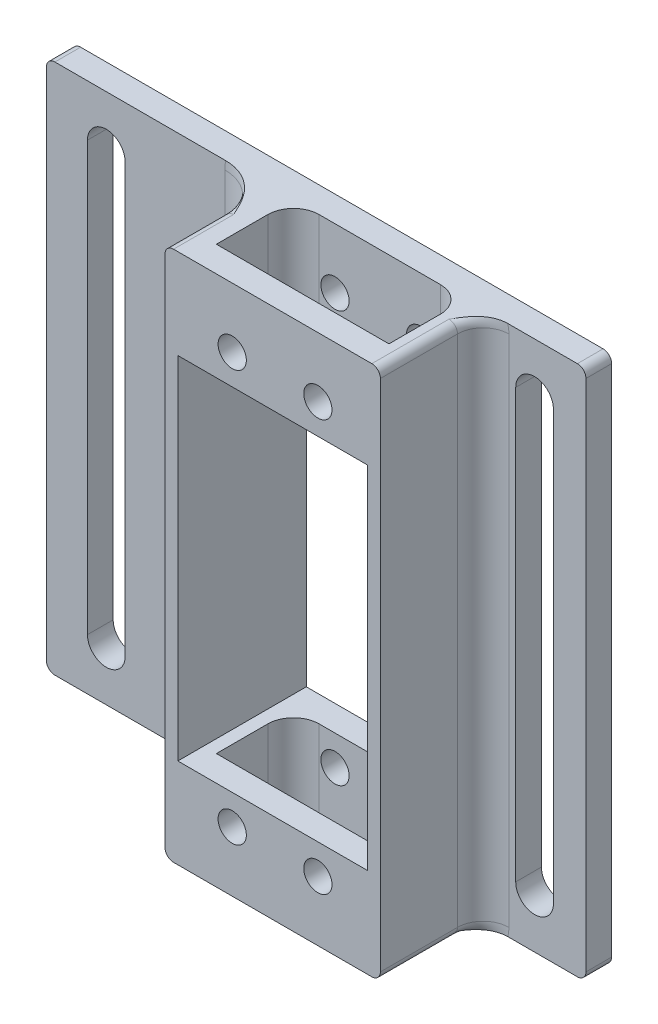
from build123d import *

# Parameters (mm, degrees)
SKETCH_1_W          = 63
SKETCH_1_H          = 62
EXTRUDE_1_DEPTH     = 3
SKETCH_2_W          = 25.15
SKETCH_2_H          = 62
SKETCH_2_R          = 1.65
EXTRUDE_2_DEPTH     = 12
CUT_EXTRUDE_START   = -45
SKETCH_4_R          = 1.65
SKETCH_4_W          = 22.15
SKETCH_4_H          = 41
CUT_EXTRUDE_4_DEPTH = 45
FILLET_1_R          = 1
FILLET_2_R          = 5
SKETCH_5_W          = 20.15
SKETCH_5_H          = 9
CUT_EXTRUDE_5_DEPTH = 70
FILLET_3_R          = 3
FILLET_4_R          = 3


with BuildPart() as part:
    # 草图1 → 凸台-拉伸1 (new body)
    with BuildSketch(Plane.XY):
        with Locations((3.5, -25)):
            Rectangle(SKETCH_1_W, SKETCH_1_H)
        with BuildLine():
            Line((26.8, 0), (26.8, -50))
            ThreePointArc((26.8, -50), (29, -52.2), (31.2, -50))
            Line((31.2, -50), (31.2, 0))
            ThreePointArc((31.2, 0), (29, 2.2), (26.8, 0))
        make_face(mode=Mode.SUBTRACT)
        with BuildLine():
            Line((-23.2, 0), (-23.2, -50))
            ThreePointArc((-23.2, -50), (-21, -52.2), (-18.8, -50))
            Line((-18.8, -50), (-18.8, 0))
            ThreePointArc((-18.8, 0), (-21, 2.2), (-23.2, 0))
        make_face(mode=Mode.SUBTRACT)
    extrude(amount=EXTRUDE_1_DEPTH)

    # 草图2 → 凸台-拉伸2 (add)
    with BuildSketch(Plane.XY.offset(3)):
        with Locations((10.425, -25)):
            Rectangle(SKETCH_2_W, SKETCH_2_H)
        with Locations((5.7, -1)):
            Circle(SKETCH_2_R, mode=Mode.SUBTRACT)
        with Locations((15.7, -1)):
            Circle(SKETCH_2_R, mode=Mode.SUBTRACT)
        with Locations((15.7, -49)):
            Circle(SKETCH_2_R, mode=Mode.SUBTRACT)
        with Locations((5.7, -49)):
            Circle(SKETCH_2_R, mode=Mode.SUBTRACT)
    extrude(amount=EXTRUDE_2_DEPTH)

    # 草图4 → 切除-拉伸4 (cut)
    with BuildSketch(Plane.XY.offset(15).offset(CUT_EXTRUDE_START)):
        with Locations((5.7, -1)):
            Circle(SKETCH_4_R)
        with Locations((5.7, -49)):
            Circle(SKETCH_4_R)
        with Locations((15.7, -49)):
            Circle(SKETCH_4_R)
        with Locations((15.7, -1)):
            Circle(SKETCH_4_R)
        with Locations((10.425, -25)):
            Rectangle(SKETCH_4_W, SKETCH_4_H)
    extrude(amount=CUT_EXTRUDE_4_DEPTH, mode=Mode.SUBTRACT)

    # 圆角1
    fillet_1_edges = [part.edges().sort_by_distance(p)[0] for p in [
        (-2.15, 6, 9),
        (-2.15, -56, 9),
        (23, -56, 9),
        (23, 6, 9),
        (-28, 6, 1.5),
        (35, 6, 1.5),
        (35, -56, 1.5),
        (-28, -56, 1.5),
    ]]
    fillet(fillet_1_edges, radius=FILLET_1_R)

    # 圆角2
    # the kernel refuses this fillet: 5 mm, written as the material it adds along each edge
    with BuildSketch(Plane(origin=(-2.15, -55, 3), x_dir=(0, 0, 1), z_dir=(0, 1, 0))) as fillet_2_piece_1:
        with BuildLine():
            CenterArc((FILLET_2_R, -FILLET_2_R), FILLET_2_R, 90, 90)
            Line((0, -FILLET_2_R), (0, 0))
            Line((0, 0), (FILLET_2_R, 0))
        make_face()
    extrude(amount=60)
    with BuildSketch(Plane(origin=(-1.15, 5, 3), x_dir=(-0.9999802608561372, -0.006283143965558402, 0), z_dir=(-0.006283143965558402, 0.9999802608561372, 0))) as fillet_2_piece_2_section:
        with BuildLine():
            CenterArc((-1 - FILLET_2_R, FILLET_2_R), FILLET_2_R, 270, 90)
            Line((-1 - FILLET_2_R, 0), (-1, 0))
            Line((-1, 0), (-1, FILLET_2_R))
        make_face()
    fillet_2_piece_2 = revolve(axis=Axis((-1.15, 5, 3), (0, 0, 1)), revolution_arc=359.64, mode=Mode.PRIVATE)
    fillet_2_piece_2 = split(fillet_2_piece_2, bisect_by=Plane(origin=(-1.917475009, 6, 5.017645476), z_dir=(0, -1, 0)), keep=Keep.TOP, mode=Mode.PRIVATE)
    add(fillet_2_piece_2)
    with BuildSketch(Plane(origin=(-1.15, -55, 3), x_dir=(-0.9999802608561372, 0.006283143965561067, 0), z_dir=(-0.006283143965561067, -0.9999802608561372, 0))) as fillet_2_piece_3_section:
        with BuildLine():
            CenterArc((-1 - FILLET_2_R, -FILLET_2_R), FILLET_2_R, 0, 90)
            Line((-1 - FILLET_2_R, 0), (-1, 0))
            Line((-1, 0), (-1, -FILLET_2_R))
        make_face()
    fillet_2_piece_3 = revolve(axis=Axis((-1.15, -55, 3), (0, 0, -1)), revolution_arc=359.64, mode=Mode.PRIVATE)
    fillet_2_piece_3 = split(fillet_2_piece_3, bisect_by=Plane(origin=(-1.917475041, -56, 5.017645533), z_dir=(0, 1, 0)), keep=Keep.TOP, mode=Mode.PRIVATE)
    add(fillet_2_piece_3)

    # 草图5 → 切除-拉伸5 (cut)
    with BuildSketch(Plane(origin=(0, -56, 0), x_dir=(-1, 0, 0), z_dir=(0, -1, 0))):
        with Locations((-10.925, -7.5)):
            Rectangle(SKETCH_5_W, SKETCH_5_H)
    extrude(amount=-CUT_EXTRUDE_5_DEPTH, mode=Mode.SUBTRACT)

    # 圆角3
    fillet_3_edges = [part.edges().sort_by_distance(p)[0] for p in [
        (0.85, 0.75, 3),
        (0.85, -50.75, 3),
        (21, 0.75, 3),
        (21, -50.75, 3),
    ]]
    fillet(fillet_3_edges, radius=FILLET_3_R)

    # 圆角4
    # the kernel refuses this fillet: 3 mm, written as the material it adds along each edge
    with BuildSketch(Plane(origin=(23, 5, 3), x_dir=(1, 0, 0), z_dir=(0, -1, 0))) as fillet_4_piece_1:
        with BuildLine():
            CenterArc((FILLET_4_R, FILLET_4_R), FILLET_4_R, 180, 90)
            Line((0, FILLET_4_R), (0, 0))
            Line((0, 0), (FILLET_4_R, 0))
        make_face()
    extrude(amount=60)
    with BuildSketch(Plane(origin=(22, 5, 3), x_dir=(0.9999802608561372, -0.0062831439655584, 0), z_dir=(0.0062831439655584, 0.9999802608561372, 0))) as fillet_4_piece_2_section:
        with BuildLine():
            CenterArc((-1 - FILLET_4_R, -FILLET_4_R), FILLET_4_R, 0, 90)
            Line((-1, -FILLET_4_R), (-1, 0))
            Line((-1, 0), (-1 - FILLET_4_R, 0))
        make_face()
    fillet_4_piece_2 = revolve(axis=Axis((22, 5, 3), (0, 0, -1)), revolution_arc=359.64, mode=Mode.PRIVATE)
    fillet_4_piece_2 = split(fillet_4_piece_2, bisect_by=Plane(origin=(22.764056834, 6, 4.135633635), z_dir=(0, -1, 0)), keep=Keep.TOP, mode=Mode.PRIVATE)
    add(fillet_4_piece_2)
    with BuildSketch(Plane(origin=(22, -55, 3), x_dir=(0.9999802608561372, 0.006283143965561065, 0), z_dir=(0.006283143965561065, -0.9999802608561372, 0))) as fillet_4_piece_3_section:
        with BuildLine():
            CenterArc((-1 - FILLET_4_R, FILLET_4_R), FILLET_4_R, 270, 90)
            Line((-1 - FILLET_4_R, 0), (-1, 0))
            Line((-1, 0), (-1, FILLET_4_R))
        make_face()
    fillet_4_piece_3 = revolve(axis=Axis((22, -55, 3), (0, 0, 1)), revolution_arc=359.64, mode=Mode.PRIVATE)
    fillet_4_piece_3 = split(fillet_4_piece_3, bisect_by=Plane(origin=(22.76405677, -56, 4.135633616), z_dir=(0, 1, 0)), keep=Keep.TOP, mode=Mode.PRIVATE)
    add(fillet_4_piece_3)


solid = part.part
